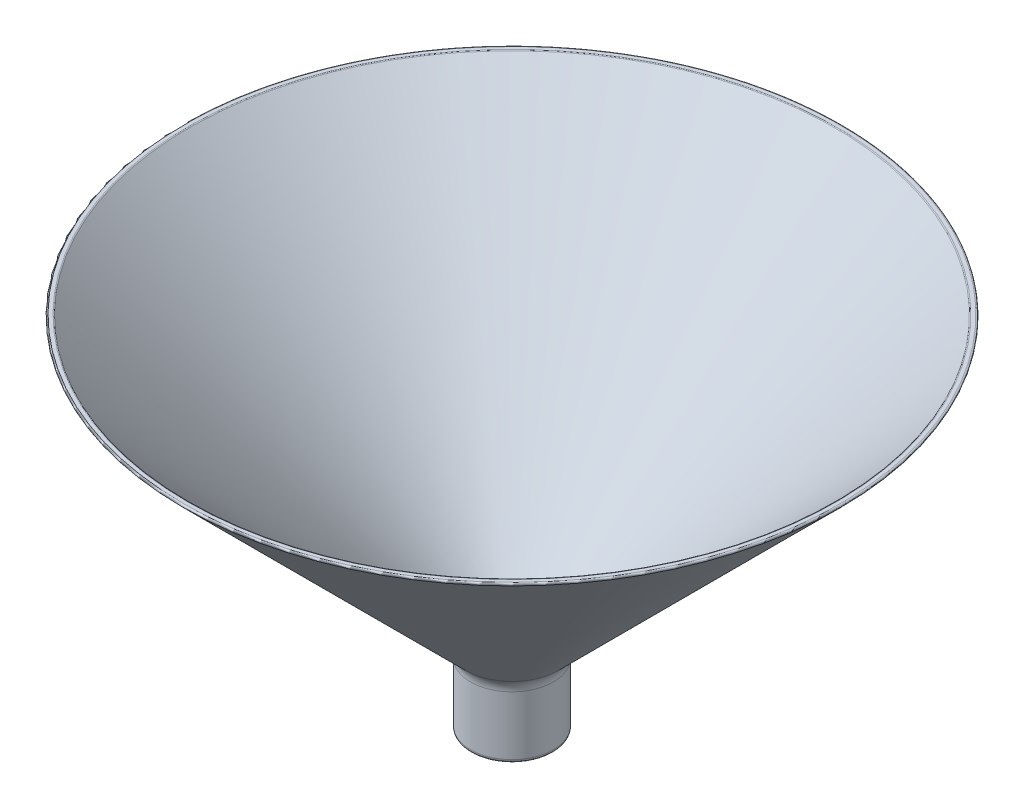
from build123d import *

# Parameters (mm, degrees)
FILLET1_R = 5
FILLET2_R = 0.4
FILLET3_R = 1


with BuildPart() as part:
    # Sketch1 → Revolve1 (revolve)
    with BuildSketch(Plane.XY):
        Polygon((10, 6.92820323), (10, 20), (90, 100), (92.121320344, 100), (11.5, 19.378679656), (11.5, 6.526279442), (11.5, 0), (6, 0), align=None)
    revolve(axis=Axis((0, 0, 0), (0, 1, 0)))

    # Fillet1
    fillet1_edges = [part.edges().sort_by_distance(p)[0] for p in [
        (-11.5, 19.378679656, 0),
        (-10, 20, 0),
    ]]
    fillet(fillet1_edges, radius=FILLET1_R)

    # Fillet2
    fillet2_edges = [part.edges().sort_by_distance(p)[0] for p in [
        (-90, 100, 0),
        (-92.121320344, 100, 0),
    ]]
    fillet(fillet2_edges, radius=FILLET2_R)

    # Fillet3
    fillet3_edges = [part.edges().sort_by_distance(p)[0] for p in [
        (-11.5, 0, 0),
    ]]
    fillet(fillet3_edges, radius=FILLET3_R)


solid = part.part
